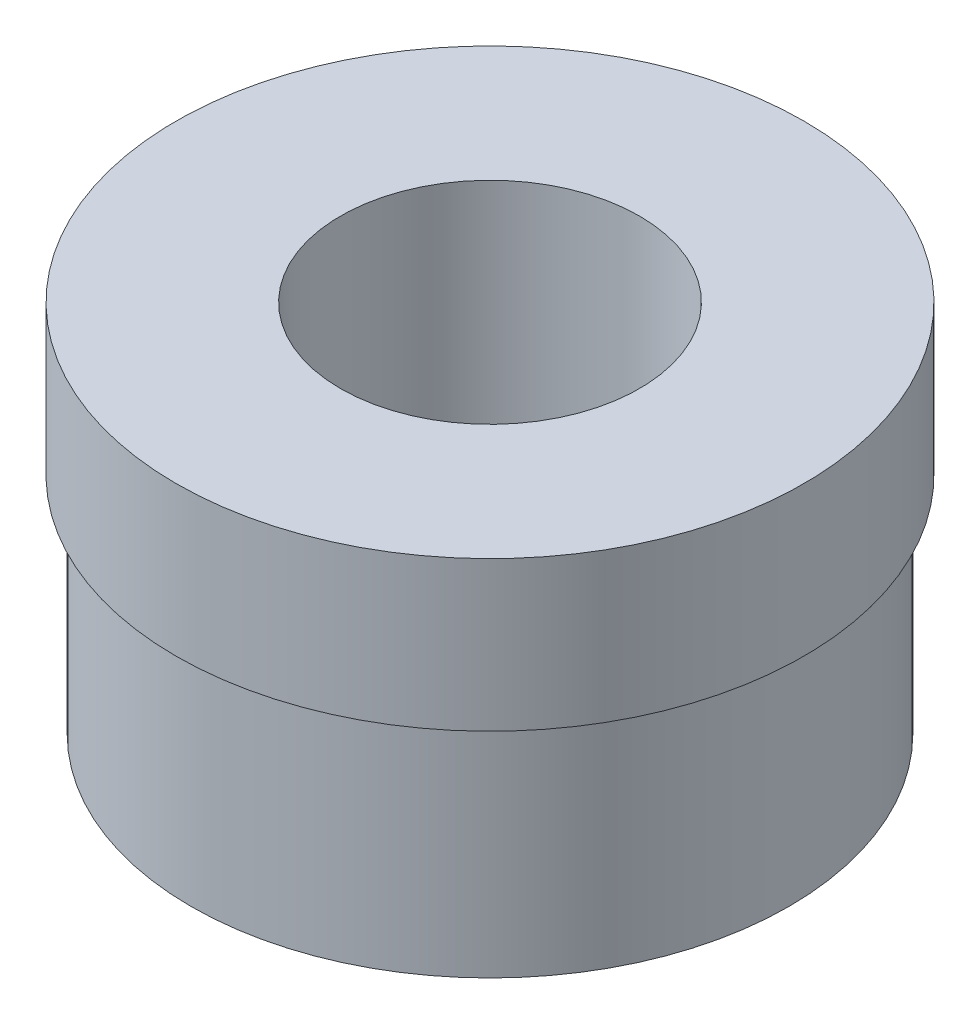
from build123d import *


with BuildPart() as part:
    # Sketch1 → Revolve1 (revolve)
    with BuildSketch(Plane.XY):
        Polygon((10, 0), (10, 25), (21, 25), (21, 15), (20, 15), (20, 0), align=None)
    revolve(axis=Axis((0, 61.834862385, 0), (0, -1, 0)))


solid = part.part
